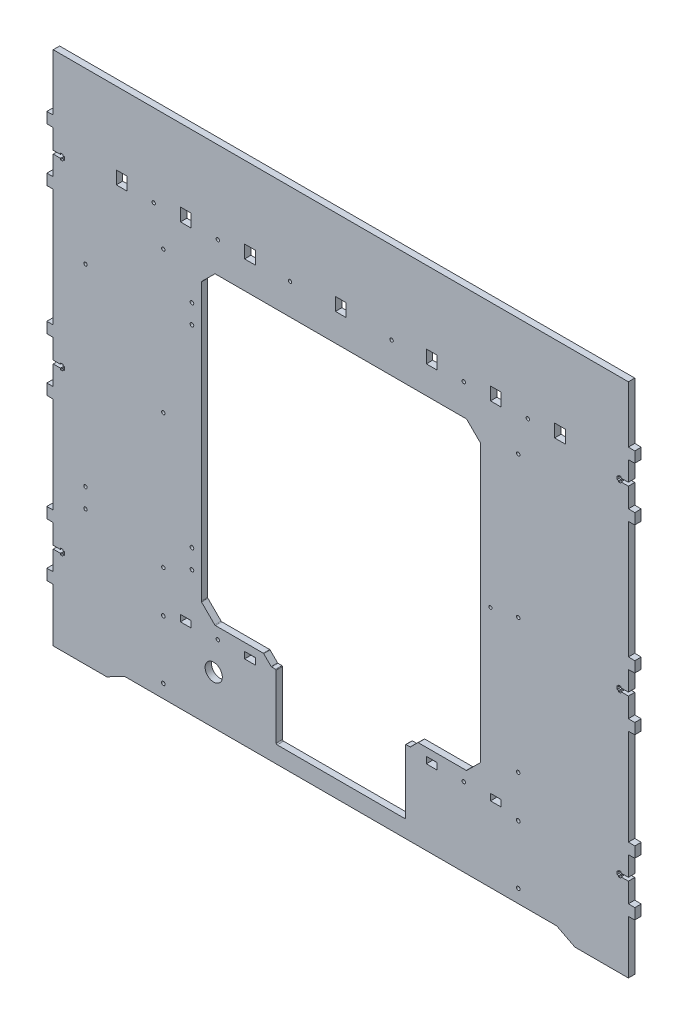
from build123d import *

# Parameters (mm, degrees)
SKETCH_2_R      = 1.6
SKETCH_2_R_2    = 1.7
SKETCH_2_R_3    = 8.05
SKETCH_2_R_4    = 1.5
SKETCH_2_W      = 10
SKETCH_2_H      = 12.1
SKETCH_2_H_2    = 6.1
EXTRUDE_2_DEPTH = 6


with BuildPart() as part:
    # Эскиз2 → Бобышка-Вытянуть2 (new body)
    with BuildSketch(Plane.XY):
        Polygon((39.191925364, 472.107239), (33.191925364, 472.007239), (33.191925364, 462.007239), (39.191925364, 461.907239), (39.191925364, 443.557239), (45.991925364, 443.557239), (45.991925364, 444.757239), (48.191925364, 444.757239), (48.191925364, 443.557239), (49.691925364, 443.557239), (49.691925364, 440.457239), (48.191925364, 440.457239), (48.191925364, 439.257239), (45.991925364, 439.257239), (45.991925364, 440.457239), (39.191925364, 440.457239), (39.191925364, 422.107239), (33.191925364, 422.007239), (33.191925364, 412.007239), (39.191925364, 411.907239), (39.191925364, 302.107239), (33.191925364, 302.007239), (33.191925364, 292.007239), (39.191925364, 291.907239), (39.191925364, 273.557239), (45.991925364, 273.557239), (45.991925364, 274.757239), (48.191925364, 274.757239), (48.191925364, 273.557239), (49.691925364, 273.557239), (49.691925364, 270.457239), (48.191925364, 270.457239), (48.191925364, 269.257239), (45.991925364, 269.257239), (45.991925364, 270.457239), (39.191925364, 270.457239), (39.191925364, 252.107239), (33.191925364, 252.007239), (33.191925364, 242.007239), (39.191925364, 241.907239), (39.191925364, 152.107239), (33.191925364, 152.007239), (33.191925364, 142.007239), (39.191925364, 141.907239), (39.191925364, 123.557239), (45.991925364, 123.557239), (45.991925364, 124.757239), (48.191925364, 124.757239), (48.191925364, 123.557239), (49.691925364, 123.557239), (49.691925364, 120.457239), (48.191925364, 120.457239), (48.191925364, 119.257239), (45.991925364, 119.257239), (45.991925364, 120.457239), (39.191925364, 120.457239), (39.191925364, 102.107239), (33.191925364, 102.007239), (33.191925364, 92.007239), (39.191925364, 91.907239), (39.191925364, 42.007239), (89.191925364, 42.007239), (106.191925364, 50.707239), (510.191925364, 50.707239), (527.191925364, 42.007239), (577.191925364, 42.007239), (577.191925364, 91.907239), (583.191925364, 92.007239), (583.191925364, 102.007239), (577.191925364, 102.107239), (577.191925364, 120.457239), (570.391925364, 120.457239), (570.391925364, 119.257239), (568.191925364, 119.257239), (568.191925364, 120.457239), (566.691925364, 120.457239), (566.691925364, 123.557239), (568.191925364, 123.557239), (568.191925364, 124.757239), (570.391925364, 124.757239), (570.391925364, 123.557239), (577.191925364, 123.557239), (577.191925364, 141.907239), (583.191925364, 142.007239), (583.191925364, 152.007239), (577.191925364, 152.107239), (577.191925364, 241.907239), (583.191925364, 242.007239), (583.191925364, 252.007239), (577.191925364, 252.107239), (577.191925364, 270.457239), (570.391925364, 270.457239), (570.391925364, 269.257239), (568.191925364, 269.257239), (568.191925364, 270.457239), (566.691925364, 270.457239), (566.691925364, 273.557239), (568.191925364, 273.557239), (568.191925364, 274.757239), (570.391925364, 274.757239), (570.391925364, 273.557239), (577.191925364, 273.557239), (577.191925364, 291.907239), (583.191925364, 292.007239), (583.191925364, 302.007239), (577.191925364, 302.107239), (577.191925364, 411.907239), (583.191925364, 412.007239), (583.191925364, 422.007239), (577.191925364, 422.107239), (577.191925364, 440.457239), (570.391925364, 440.457239), (570.391925364, 439.257239), (568.191925364, 439.257239), (568.191925364, 440.457239), (566.691925364, 440.457239), (566.691925364, 443.557239), (568.191925364, 443.557239), (568.191925364, 444.757239), (570.391925364, 444.757239), (570.391925364, 443.557239), (577.191925364, 443.557239), (577.191925364, 461.907239), (583.191925364, 462.007239), (583.191925364, 472.007239), (577.191925364, 472.107239), (577.191925364, 525.007239), (39.191925364, 525.007239), align=None)
        with Locations((260.691925364, 448.057239)):
            Circle(SKETCH_2_R, mode=Mode.SUBTRACT)
        with Locations((193.191925364, 448.057239)):
            Circle(SKETCH_2_R, mode=Mode.SUBTRACT)
        with Locations((69.364369364, 366.459314)):
            Circle(SKETCH_2_R, mode=Mode.SUBTRACT)
        with Locations((69.364369364, 186.089314)):
            Circle(SKETCH_2_R, mode=Mode.SUBTRACT)
        with Locations((69.364369364, 168.089314)):
            Circle(SKETCH_2_R, mode=Mode.SUBTRACT)
        with Locations((193.191925364, 124.054914)):
            Circle(SKETCH_2_R, mode=Mode.SUBTRACT)
        with Locations((142.191925364, 117.904914)):
            Circle(SKETCH_2_R_2, mode=Mode.SUBTRACT)
        with Locations((142.191925364, 63.104914)):
            Circle(SKETCH_2_R_2, mode=Mode.SUBTRACT)
        with Locations((189.304525403, 95.826887814)):
            Circle(SKETCH_2_R_3, mode=Mode.SUBTRACT)
        with Locations((474.191925364, 63.104914)):
            Circle(SKETCH_2_R_2, mode=Mode.SUBTRACT)
        with Locations((474.191925364, 117.904914)):
            Circle(SKETCH_2_R_2, mode=Mode.SUBTRACT)
        with Locations((423.191925364, 124.054914)):
            Circle(SKETCH_2_R, mode=Mode.SUBTRACT)
        with Locations((423.191925364, 448.057239)):
            Circle(SKETCH_2_R, mode=Mode.SUBTRACT)
        with Locations((355.691925364, 448.057239)):
            Circle(SKETCH_2_R, mode=Mode.SUBTRACT)
        with Locations((483.191925364, 448.057239)):
            Circle(SKETCH_2_R, mode=Mode.SUBTRACT)
        with Locations((133.191925364, 448.057239)):
            Circle(SKETCH_2_R, mode=Mode.SUBTRACT)
        with Locations((474.191925364, 415.007239)):
            Circle(SKETCH_2_R, mode=Mode.SUBTRACT)
        with Locations((474.191925364, 282.507239)):
            Circle(SKETCH_2_R, mode=Mode.SUBTRACT)
        with Locations((474.191925364, 157.104914)):
            Circle(SKETCH_2_R, mode=Mode.SUBTRACT)
        with Locations((142.191925364, 157.104914)):
            Circle(SKETCH_2_R, mode=Mode.SUBTRACT)
        with Locations((142.191925364, 282.507239)):
            Circle(SKETCH_2_R, mode=Mode.SUBTRACT)
        with Locations((142.191925364, 415.007239)):
            Circle(SKETCH_2_R, mode=Mode.SUBTRACT)
        with Locations((168.964369364, 384.962673)):
            Circle(SKETCH_2_R_2, mode=Mode.SUBTRACT)
        with Locations((168.964369364, 366.962673)):
            Circle(SKETCH_2_R_2, mode=Mode.SUBTRACT)
        with Locations((168.964369364, 186.592382)):
            Circle(SKETCH_2_R_2, mode=Mode.SUBTRACT)
        with Locations((168.964369364, 168.592382)):
            Circle(SKETCH_2_R_2, mode=Mode.SUBTRACT)
        with Locations((448.149003364, 277.669314)):
            Circle(SKETCH_2_R_4, mode=Mode.SUBTRACT)
        with Locations((308.191925364, 451.057239)):
            Rectangle(SKETCH_2_W, SKETCH_2_H, mode=Mode.SUBTRACT)
        with Locations((223.191925364, 124.054914)):
            Rectangle(SKETCH_2_W, SKETCH_2_H_2, mode=Mode.SUBTRACT)
        with Locations((163.191925364, 124.054914)):
            Rectangle(SKETCH_2_W, SKETCH_2_H_2, mode=Mode.SUBTRACT)
        with Locations((163.191925364, 451.057239)):
            Rectangle(SKETCH_2_W, SKETCH_2_H, mode=Mode.SUBTRACT)
        with Locations((223.191925364, 451.057239)):
            Rectangle(SKETCH_2_W, SKETCH_2_H, mode=Mode.SUBTRACT)
        with BuildLine():
            Line((367.691925364, 66.604914), (248.691925364, 66.604914))
            ThreePointArc((248.691925364, 66.604914), (247.984818583, 66.897807219), (247.691925364, 67.604914))
            Line((247.691925364, 67.604914), (247.691925364, 126.604914))
            ThreePointArc((247.691925364, 126.604914), (247.545478755, 126.958467391), (247.191925364, 127.104914))
            Line((247.191925364, 127.104914), (243.399032145, 127.104914))
            ThreePointArc((243.399032145, 127.104914), (243.207690429, 127.142974234), (243.045478755, 127.251360609))
            Line((243.045478755, 127.251360609), (239.551511864, 130.7453275))
            Line((239.551511864, 130.7453275), (236.057544974, 134.239294391))
            ThreePointArc((236.057544974, 134.239294391), (235.895333299, 134.347680766), (235.703991583, 134.385741))
            Line((235.703991583, 134.385741), (213.330786974, 134.385741))
            Line((213.330786974, 134.385741), (190.957582097, 134.385741))
            ThreePointArc((190.957582097, 134.385741), (190.576531552, 134.461186793), (190.252978328, 134.676140036))
            Line((190.252978328, 134.676140036), (184.106371864, 140.7794605))
            Line((184.106371864, 140.7794605), (177.959765595, 146.882780771))
            ThreePointArc((177.959765595, 146.882780771), (177.74116739, 147.20806661), (177.664369364, 147.592381735))
            Line((177.664369364, 147.592381735), (177.664369364, 169.701128817))
            Line((177.664369364, 169.701128817), (177.664369364, 405.962673265))
            ThreePointArc((177.664369364, 405.962673265), (177.741167398, 406.346988409), (177.959765623, 406.672274257))
            Line((177.959765623, 406.672274257), (184.106372364, 412.7755945))
            Line((184.106372364, 412.7755945), (190.252979357, 418.878914993))
            ThreePointArc((190.252979357, 418.878914993), (190.576532571, 419.093868215), (190.957583097, 419.169314))
            Line((190.957583097, 419.169314), (308.137936364, 419.169314))
            Line((308.137936364, 419.169314), (308.245914364, 419.169314))
            Line((308.245914364, 419.169314), (425.426267631, 419.169314))
            ThreePointArc((425.426267631, 419.169314), (425.807318157, 419.093868215), (426.130871372, 418.878914993))
            Line((426.130871372, 418.878914993), (432.277478364, 412.7755945))
            Line((432.277478364, 412.7755945), (438.424085105, 406.672274257))
            ThreePointArc((438.424085105, 406.672274257), (438.64268333, 406.346988409), (438.719481364, 405.962673265))
            Line((438.719481364, 405.962673265), (438.719481364, 169.701128817))
            Line((438.719481364, 169.701128817), (438.719481364, 147.592381735))
            ThreePointArc((438.719481364, 147.592381735), (438.642683338, 147.20806661), (438.424085134, 146.882780771))
            Line((438.424085134, 146.882780771), (432.277478864, 140.7794605))
            Line((432.277478864, 140.7794605), (426.1308724, 134.676140036))
            ThreePointArc((426.1308724, 134.676140036), (425.807319176, 134.461186793), (425.426268631, 134.385741))
            Line((425.426268631, 134.385741), (403.053063755, 134.385741))
            Line((403.053063755, 134.385741), (380.679859145, 134.385741))
            ThreePointArc((380.679859145, 134.385741), (380.488517429, 134.347680766), (380.326305755, 134.239294391))
            Line((380.326305755, 134.239294391), (376.832338864, 130.7453275))
            Line((376.832338864, 130.7453275), (373.338371974, 127.251360609))
            ThreePointArc((373.338371974, 127.251360609), (373.176160299, 127.142974234), (372.984818583, 127.104914))
            Line((372.984818583, 127.104914), (369.191925364, 127.104914))
            ThreePointArc((369.191925364, 127.104914), (368.838371974, 126.958467391), (368.691925364, 126.604914))
            Line((368.691925364, 126.604914), (368.691925364, 67.604914))
            ThreePointArc((368.691925364, 67.604914), (368.399032145, 66.897807219), (367.691925364, 66.604914))
        make_face(mode=Mode.SUBTRACT)
        with Locations((103.191925364, 451.057239)):
            Rectangle(SKETCH_2_W, SKETCH_2_H, mode=Mode.SUBTRACT)
        with Locations((513.191925364, 451.057239)):
            Rectangle(SKETCH_2_W, SKETCH_2_H, mode=Mode.SUBTRACT)
        with Locations((393.191925364, 451.057239)):
            Rectangle(SKETCH_2_W, SKETCH_2_H, mode=Mode.SUBTRACT)
        with Locations((453.191925364, 451.057239)):
            Rectangle(SKETCH_2_W, SKETCH_2_H, mode=Mode.SUBTRACT)
        with Locations((453.191925364, 124.054914)):
            Rectangle(SKETCH_2_W, SKETCH_2_H_2, mode=Mode.SUBTRACT)
        with Locations((393.191925364, 124.054914)):
            Rectangle(SKETCH_2_W, SKETCH_2_H_2, mode=Mode.SUBTRACT)
    extrude(amount=EXTRUDE_2_DEPTH)


solid = part.part
